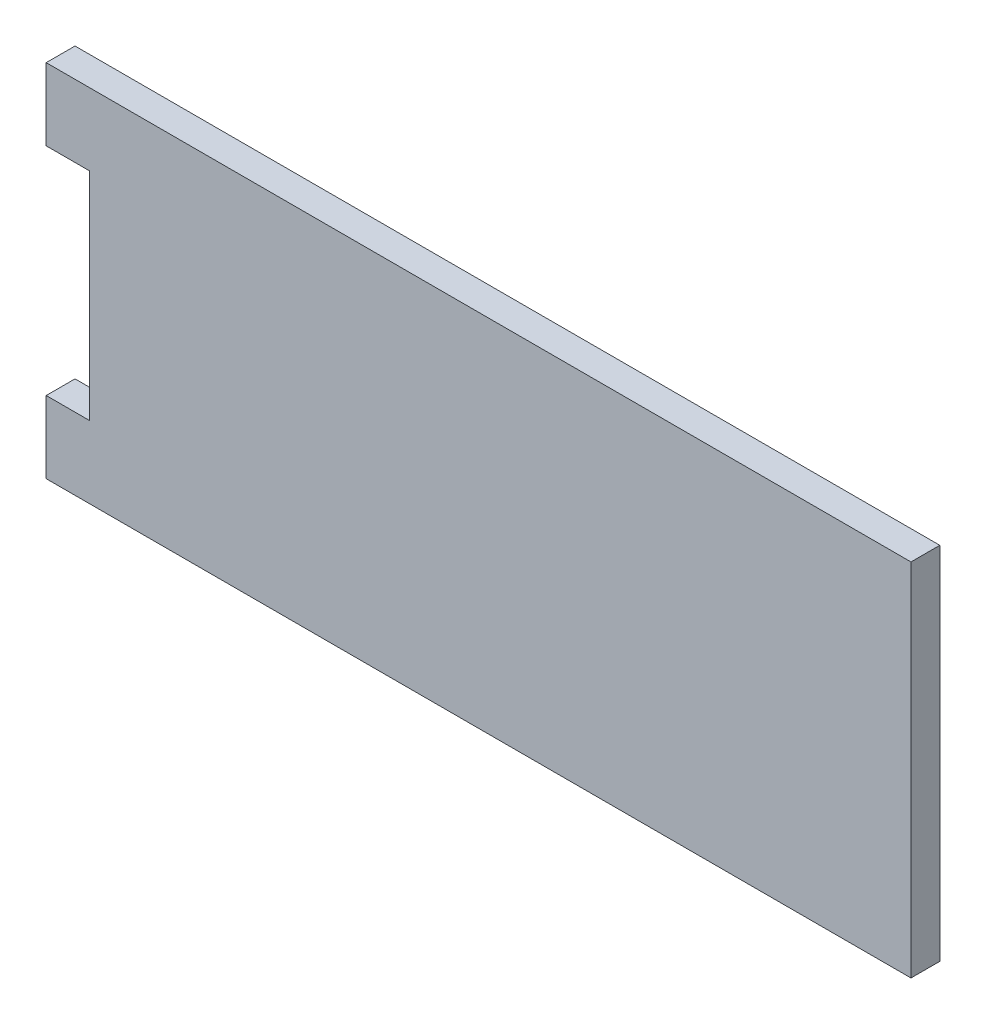
from build123d import *

# Parameters (mm, degrees)
SKETCH1_W           = 120
SKETCH1_H           = 50
BOSS_EXTRUDE1_DEPTH = 4
CUT_EXTRUDE1_REACH  = 67.123
SKETCH2_W           = 14.577237657
SKETCH2_H           = 30


with BuildPart() as part:
    # Sketch1 → Boss-Extrude1 (new body)
    with BuildSketch(Plane.XY):
        Rectangle(SKETCH1_W, SKETCH1_H)
    extrude(amount=BOSS_EXTRUDE1_DEPTH)

    # Sketch2 → Cut-Extrude1 (cut, up to next)
    with BuildSketch(Plane.XY.offset(4), mode=Mode.PRIVATE) as cut_extrude1_sk1:
        with Locations((-61.288618828, 0)):
            Rectangle(SKETCH2_W, SKETCH2_H)
    cut_extrude1_tool1 = extrude(cut_extrude1_sk1.sketch, amount=-CUT_EXTRUDE1_REACH, mode=Mode.PRIVATE) & part.part
    add(cut_extrude1_tool1.solids().sort_by_distance((-61.288619, 0, 4))[0], mode=Mode.SUBTRACT)


solid = part.part
